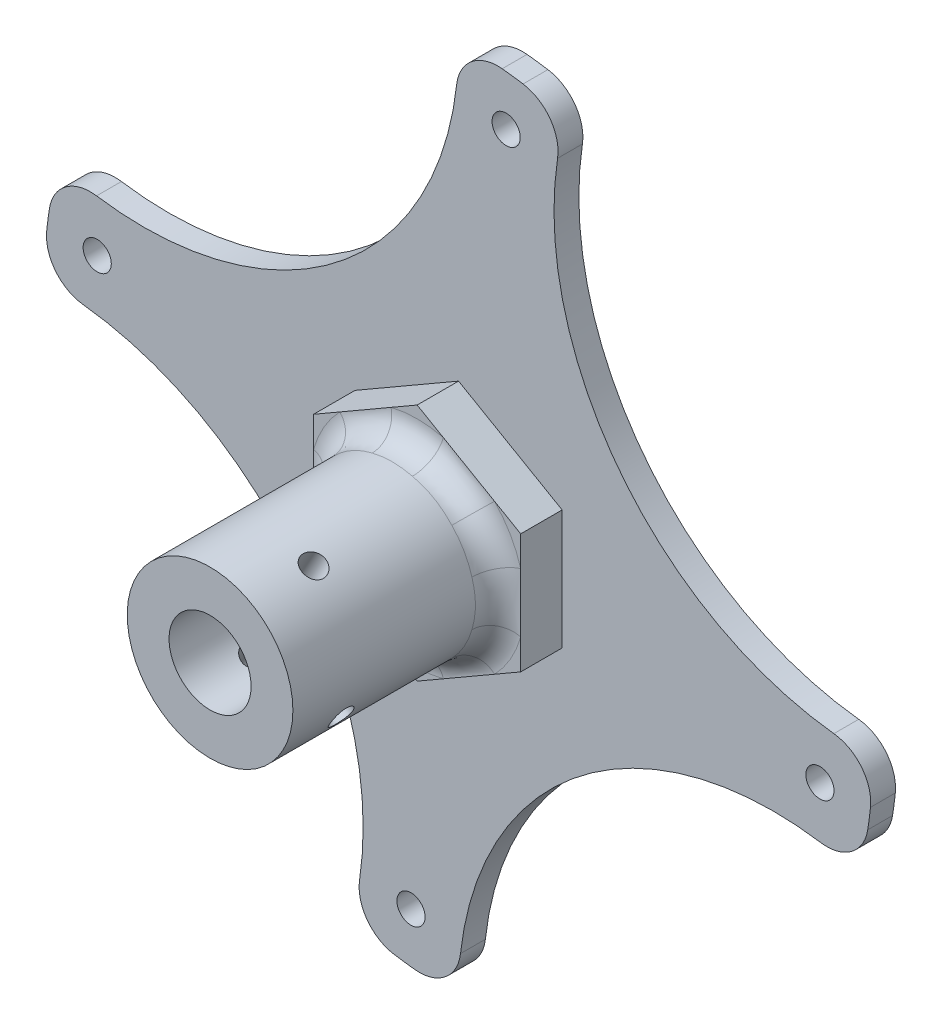
from build123d import *

# Parameters (mm, degrees)
SKETCH1_R                           = 50
BOSS_EXTRUDE1_DEPTH                 = 3
BOSS_EXTRUDE2_DEPTH                 = 5
SKETCH3_R                           = 10
BOSS_EXTRUDE3_DEPTH                 = 25
FILLET1_R                           = 3
SKETCH4_R                           = 4.95
CUT_EXTRUDE1_DEPTH                  = 79.0320447
F_1_0MM_DOWEL_HOLE1_D               = 2.8
F_1_0MM_DOWEL_HOLE1_DEPTH           = 33.158795133
F_1_0MM_DOWEL_HOLE1_TIP             = 0.841204867
F_1_0MM_DOWEL_HOLE1_ON_FACE_2_D     = 2.8
F_1_0MM_DOWEL_HOLE1_ON_FACE_2_DEPTH = 33.158795133
F_1_0MM_DOWEL_HOLE1_ON_FACE_2_TIP   = 0.841204867
CUT_EXTRUDE2_START                  = -25
CUT_EXTRUDE2_DEPTH                  = 25
FILLET2_R                           = 5
F_1_0MM_DOWEL_HOLE2_D               = 3.4
F_1_0MM_DOWEL_HOLE2_DEPTH           = 32.978536948
F_1_0MM_DOWEL_HOLE2_TIP             = 1.021463052


with BuildPart() as part:
    # Sketch1 → Boss-Extrude1 (new body)
    with BuildSketch(Plane.XY):
        Circle(SKETCH1_R)
    extrude(amount=BOSS_EXTRUDE1_DEPTH)

    # Sketch2 → Boss-Extrude2 (add)
    with BuildSketch(Plane.XY.offset(3)):
        Polygon((12.5, -7.216878365), (12.5, 7.216878365), (0, 14.43375673), (-12.5, 7.216878365), (-12.5, -7.216878365), (0, -14.43375673), align=None)
    extrude(amount=BOSS_EXTRUDE2_DEPTH)

    # Sketch3 → Boss-Extrude3 (add)
    with BuildSketch(Plane.XY.offset(8)):
        Circle(SKETCH3_R)
    extrude(amount=BOSS_EXTRUDE3_DEPTH)

    # Fillet1
    fillet1_edges = [part.edges().sort_by_distance(p)[0] for p in [
        (-10, 0, 8),
    ]]
    fillet(fillet1_edges, radius=FILLET1_R)

    # Sketch4 → Cut-Extrude1 (cut, through all)
    with BuildSketch(Plane.XY.offset(33)):
        Circle(SKETCH4_R)
    extrude(amount=-CUT_EXTRUDE1_DEPTH, mode=Mode.SUBTRACT)

    # Ø1.0mm Dowel Hole1
    with Locations(Plane(origin=(-8.696036674, 4.937504042, 25.857386746), x_dir=(-0.493750404175, -0.869603667413, 0), z_dir=(-0.869603667413, 0.493750404175, 0))):
        with Locations((0, 0)):
            Hole(F_1_0MM_DOWEL_HOLE1_D / 2, depth=F_1_0MM_DOWEL_HOLE1_DEPTH)
            with Locations((0, 0, -(F_1_0MM_DOWEL_HOLE1_DEPTH + F_1_0MM_DOWEL_HOLE1_TIP / 2))):  # 118° drill point
                Cone(0, F_1_0MM_DOWEL_HOLE1_D / 2, F_1_0MM_DOWEL_HOLE1_TIP, mode=Mode.SUBTRACT)

    # Ø1.0mm Dowel Hole1 on face 2
    with Locations(Plane(origin=(4.844249125, 8.748328435, 25.328642637), x_dir=(0.87483284318, -0.484424913163, 0), z_dir=(0.484424913163, 0.87483284318, 0))):
        with Locations((0, 0)):
            Hole(F_1_0MM_DOWEL_HOLE1_ON_FACE_2_D / 2, depth=F_1_0MM_DOWEL_HOLE1_ON_FACE_2_DEPTH)
            with Locations((0, 0, -(F_1_0MM_DOWEL_HOLE1_ON_FACE_2_DEPTH + F_1_0MM_DOWEL_HOLE1_ON_FACE_2_TIP / 2))):  # 118° drill point
                Cone(0, F_1_0MM_DOWEL_HOLE1_ON_FACE_2_D / 2, F_1_0MM_DOWEL_HOLE1_ON_FACE_2_TIP, mode=Mode.SUBTRACT)

    # Sketch6 → Cut-Extrude2 (cut)
    with BuildSketch(Plane.XY.offset(3).offset(CUT_EXTRUDE2_START)):
        with BuildLine():
            Line((-49.037179863, 0), (-50, 0))
            ThreePointArc((-50, 0), (-39.667667015, -30.43807145), (-12.940952255, -48.296291314))
            ThreePointArc((-12.940952255, -48.296291314), (-19.080518481, -15.247800886), (-49.037179863, 0))
        make_face()
        with BuildLine():
            ThreePointArc((0, 50), (-30.43807145, 39.667667015), (-48.296291314, 12.940952255))
            Line((-48.296291314, 12.940952255), (-47.366278478, 12.691756067))
            ThreePointArc((-47.366278478, 12.691756067), (-14.483944315, 19.666646244), (0, 50))
        make_face()
        with BuildLine():
            ThreePointArc((48.296291314, -12.940952255), (14.864016159, -19.371163), (0, -50))
            ThreePointArc((0, -50), (30.43807145, -39.667667015), (48.296291314, -12.940952255))
        make_face()
        with BuildLine():
            ThreePointArc((50, 0), (39.667667015, 30.43807145), (12.940952255, 48.296291314))
            ThreePointArc((12.940952255, 48.296291314), (19.371163, 14.864016159), (50, 0))
        make_face()
    extrude(amount=CUT_EXTRUDE2_DEPTH, mode=Mode.SUBTRACT)

    # Fillet2
    fillet2_edges = [part.edges().sort_by_distance(p)[0] for p in [
        (-48.296291314, 12.940952255, 1.5),
        (-50, 0, 1.5),
        (-12.940952255, -48.296291314, 1.5),
        (0, -50, 1.5),
        (48.296291314, -12.940952255, 1.5),
        (50, 0, 1.5),
        (0, 50, 1.5),
        (12.940952255, 48.296291314, 1.5),
    ]]
    fillet(fillet2_edges, radius=FILLET2_R)

    # Ø1.0mm Dowel Hole2
    with Locations(Plane(origin=(5.743152458, 43.6235739, 0), x_dir=(-1, 0, 0), z_dir=(0, 0, -1))):
        with Locations((0, 0), (49.366726358, -37.880421442), (11.486304916, -87.2471478), (-37.880421442, -49.366726358)):
            Hole(F_1_0MM_DOWEL_HOLE2_D / 2, depth=F_1_0MM_DOWEL_HOLE2_DEPTH)
            with Locations((0, 0, -(F_1_0MM_DOWEL_HOLE2_DEPTH + F_1_0MM_DOWEL_HOLE2_TIP / 2))):  # 118° drill point
                Cone(0, F_1_0MM_DOWEL_HOLE2_D / 2, F_1_0MM_DOWEL_HOLE2_TIP, mode=Mode.SUBTRACT)


solid = part.part
